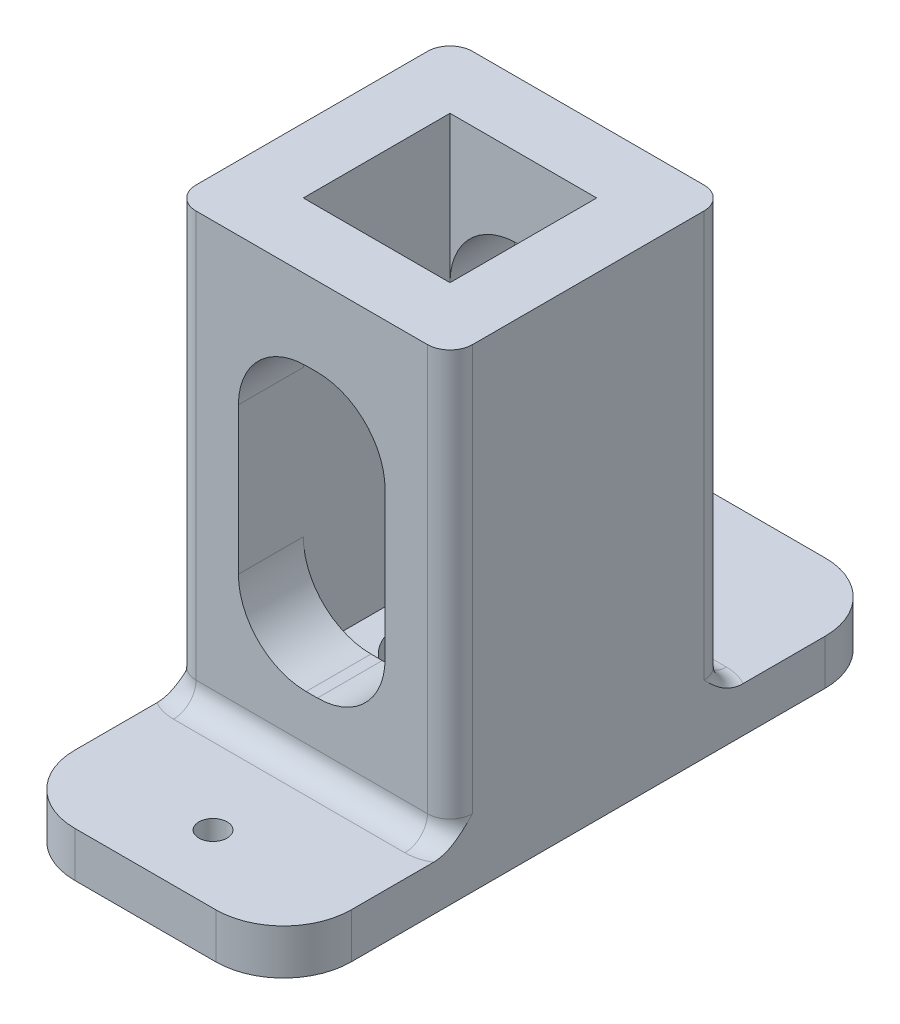
from build123d import *

# Parameters (mm, degrees)
SKETCH_1_W          = 24.5
SKETCH_1_H          = 24.5
EXTRUDE_1_DEPTH     = 38
EXTRUDE_2_DEPTH     = 4
SKETCH_3_W          = 13
SKETCH_3_H          = 13
CUT_EXTRUDE_1_DEPTH = 35
SKETCH_4_R          = 4.5
CUT_EXTRUDE_2_DEPTH = 59.015622896
CUT_EXTRUDE_3_DEPTH = 60.873303734
FILLET_1_R          = 2
SKETCH_6_R          = 1.25
CUT_EXTRUDE_4_DEPTH = 63.488498942
FILLET_2_R          = 2


with BuildPart() as part:
    # Эскиз1 → Бобышка-Вытянуть1 (new body)
    with BuildSketch(Plane(origin=(0, 0, 0), x_dir=(1, 0, 0), z_dir=(0, 1, 0))):
        with Locations((12.25, 12.25)):
            Rectangle(SKETCH_1_W, SKETCH_1_H)
    extrude(amount=EXTRUDE_1_DEPTH)

    # Эскиз2 → Бобышка-Вытянуть2 (add)
    with BuildSketch(Plane.XZ):
        with BuildLine():
            Line((24.5, -24.5), (24.5, -33.25))
            ThreePointArc((24.5, -33.25), (22.742640687, -37.492640687), (18.5, -39.25))
            Line((18.5, -39.25), (6, -39.25))
            ThreePointArc((6, -39.25), (1.757359313, -37.492640687), (0, -33.25))
            Line((0, -33.25), (0, -24.5))
            Line((0, -24.5), (0, 0))
            Line((0, 0), (0, 8.75))
            ThreePointArc((0, 8.75), (1.757359313, 12.992640687), (6, 14.75))
            Line((6, 14.75), (18.5, 14.75))
            ThreePointArc((18.5, 14.75), (22.742640687, 12.992640687), (24.5, 8.75))
            Line((24.5, 8.75), (24.5, 0))
            Line((24.5, 0), (24.5, -24.5))
        make_face()
    extrude(amount=EXTRUDE_2_DEPTH)

    # Эскиз3 → Вырез-Вытянуть1 (cut)
    with BuildSketch(Plane(origin=(0, 38, 0), x_dir=(1, 0, 0), z_dir=(0, 1, 0))):
        with Locations((12.25, 12.25)):
            Rectangle(SKETCH_3_W, SKETCH_3_H)
    extrude(amount=-CUT_EXTRUDE_1_DEPTH, mode=Mode.SUBTRACT)

    # Эскиз4 → Вырез-Вытянуть2 (cut, through all)
    with BuildSketch(Plane(origin=(0, 3, 0), x_dir=(1, 0, 0), z_dir=(0, 1, 0))):
        with Locations(Location((12.25, 12.25, 0), (0, 0, 270))):
            Circle(SKETCH_4_R)
    extrude(amount=-CUT_EXTRUDE_2_DEPTH, mode=Mode.SUBTRACT)

    # Эскиз5 → Вырез-Вытянуть3 (cut, through all)
    with BuildSketch(Plane.XY):
        with BuildLine():
            Line((11.75, 31), (12.75, 31))
            ThreePointArc((12.75, 31), (16.992640687, 29.242640687), (18.75, 25))
            Line((18.75, 25), (18.75, 12))
            ThreePointArc((18.75, 12), (16.992640687, 7.757359313), (12.75, 6))
            Line((12.75, 6), (11.75, 6))
            ThreePointArc((11.75, 6), (7.507359313, 7.757359313), (5.75, 12))
            Line((5.75, 12), (5.75, 25))
            ThreePointArc((5.75, 25), (7.507359313, 29.242640687), (11.75, 31))
        make_face()
    extrude(amount=-CUT_EXTRUDE_3_DEPTH, mode=Mode.SUBTRACT)

    # Скругление1
    fillet_1_edges = [part.edges().sort_by_distance(p)[0] for p in [
        (0, 19, -24.5),
        (0, 19, 0),
        (24.5, 19, -24.5),
        (24.5, 19, 0),
    ]]
    fillet(fillet_1_edges, radius=FILLET_1_R)

    # Эскиз6 → Вырез-Вытянуть4 (cut, through all)
    with BuildSketch(Plane.XZ.offset(4)):
        with Locations(Location((12.25, 8.75, 0), (0, 0, 270))):
            Circle(SKETCH_6_R)
        with Locations(Location((12.25, -32.25, 0), (0, 0, 270))):
            Circle(SKETCH_6_R)
    extrude(amount=-CUT_EXTRUDE_4_DEPTH, mode=Mode.SUBTRACT)

    # Скругление2
    # the kernel refuses this fillet: 2 mm, written as the material it adds along each edge
    with BuildSketch(Plane(origin=(22.5, 0, -22.5), x_dir=(-0.8017442392976493, 0, 0.5976672776328263), z_dir=(-0.5976672776328263, 0, -0.8017442392976493))) as fillet_2_piece_1_section:
        with BuildLine():
            CenterArc((2 + FILLET_2_R, FILLET_2_R), FILLET_2_R, 180, 90)
            Line((2, FILLET_2_R), (2, 0))
            Line((2, 0), (2 + FILLET_2_R, 0))
        make_face()
    fillet_2_piece_1 = revolve(axis=Axis((22.5, 0, -22.5), (0, 1, 0)), revolution_arc=233.296989237, mode=Mode.PRIVATE)
    fillet_2_piece_1 = split(fillet_2_piece_1, bisect_by=Plane(origin=(24.5, 0.623256616, -23.99987789), z_dir=(-1, 0, 0)), keep=Keep.TOP, mode=Mode.PRIVATE)
    add(fillet_2_piece_1)
    with BuildSketch(Plane(origin=(2, 0, -22.5), x_dir=(0, 0, -1), z_dir=(1, 0, 0))) as fillet_2_piece_2_section:
        with BuildLine():
            CenterArc((2 + FILLET_2_R, FILLET_2_R), FILLET_2_R, 180, 90)
            Line((2, FILLET_2_R), (2, 0))
            Line((2, 0), (2 + FILLET_2_R, 0))
        make_face()
    fillet_2_piece_2 = revolve(axis=Axis((2, 0, -22.5), (0, 1, 0)), revolution_arc=233.296989237, mode=Mode.PRIVATE)
    fillet_2_piece_2 = split(fillet_2_piece_2, bisect_by=Plane(origin=(0, 0.334600406, -24.939550499), z_dir=(1, 0, 0)), keep=Keep.TOP, mode=Mode.PRIVATE)
    add(fillet_2_piece_2)
    with BuildSketch(Plane(origin=(2, 0, -2), x_dir=(0, 0, 1), z_dir=(1, 0, 0))) as fillet_2_piece_3_section:
        with BuildLine():
            CenterArc((2 + FILLET_2_R, -FILLET_2_R), FILLET_2_R, 90, 90)
            Line((2, -FILLET_2_R), (2, 0))
            Line((2, 0), (2 + FILLET_2_R, 0))
        make_face()
    fillet_2_piece_3 = revolve(axis=Axis((2, 0, -2), (0, -1, 0)), revolution_arc=233.296989237, mode=Mode.PRIVATE)
    fillet_2_piece_3 = split(fillet_2_piece_3, bisect_by=Plane(origin=(0, 0.334600403, 0.439550497), z_dir=(1, 0, 0)), keep=Keep.TOP, mode=Mode.PRIVATE)
    add(fillet_2_piece_3)
    with BuildSketch(Plane(origin=(22.5, 0, -2), x_dir=(-0.801744239297648, 0, -0.5976672776328278), z_dir=(-0.5976672776328278, 0, 0.801744239297648))) as fillet_2_piece_4_section:
        with BuildLine():
            CenterArc((2 + FILLET_2_R, -FILLET_2_R), FILLET_2_R, 90, 90)
            Line((2 + FILLET_2_R, 0), (2, 0))
            Line((2, 0), (2, -FILLET_2_R))
        make_face()
    fillet_2_piece_4 = revolve(axis=Axis((22.5, 0, -2), (0, -1, 0)), revolution_arc=233.296989237, mode=Mode.PRIVATE)
    fillet_2_piece_4 = split(fillet_2_piece_4, bisect_by=Plane(origin=(24.5, 0.623256909, -0.500122227), z_dir=(-1, 0, 0)), keep=Keep.TOP, mode=Mode.PRIVATE)
    add(fillet_2_piece_4)
    with BuildSketch(Plane(origin=(22.5, 0, -24.5), x_dir=(0, 0, -1), z_dir=(-1, 0, 0)), Plane(origin=(2, 0, 0), x_dir=(0, 0, 1), z_dir=(1, 0, 0))) as fillet_2_piece_5:
        with BuildLine():
            CenterArc((FILLET_2_R, -FILLET_2_R), FILLET_2_R, 90, 90)
            Line((0, -FILLET_2_R), (0, 0))
            Line((0, 0), (FILLET_2_R, 0))
        make_face()
    extrude(amount=20.5)


solid = part.part
